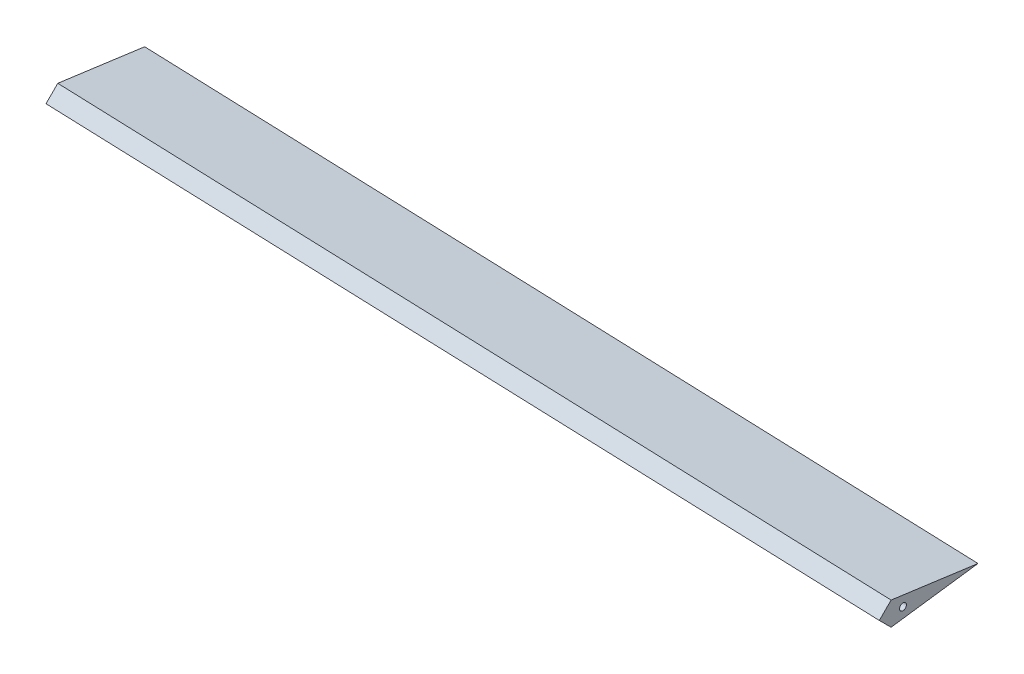
from build123d import *

# Parameters (mm, degrees)
AILERON_DEPTH           = 346.121888377
CUT_EXTRUDE2_DEPTH      = 359.183149195
CUT_EXTRUDE2_DEPTH_BACK = 359.183149195
SKETCH2_R               = 2.75


with BuildPart() as part:
    # aileron_root → aileron (new, symmetric, along a direction that is not the sketch's normal)
    with BuildSketch(Plane(origin=(0, 0, 0), x_dir=(0, 0, -1), z_dir=(1, 0, 0))):
        Polygon((-80, -10.846932253), (-80, 10.846932253), (0, 0), align=None)
    extrude(amount=AILERON_DEPTH, dir=(0.999362485653241, 0, 0.035701852458600344), both=True)

    # Sketch2 → Cut-Extrude2 (cut, two sides: drawn at the far end of the back side and taken through both)
    with BuildSketch(Plane(origin=(0, 0, 0), x_dir=(-0.03570185245860034, 0, 0.999362485653241), z_dir=(-0.999362485653241, 0, -0.03570185245860034)).offset(-CUT_EXTRUDE2_DEPTH_BACK)):
        with Locations((60, 0)):
            Circle(SKETCH2_R)
        Polygon((78.948998852, 0), (68.1020666, -10.846932253), (79.948998852, -10.846932253), (79.948998852, 10.846932253), (68.1020666, 10.846932253), align=None)
    extrude(amount=CUT_EXTRUDE2_DEPTH + CUT_EXTRUDE2_DEPTH_BACK, mode=Mode.SUBTRACT)


solid = part.part
